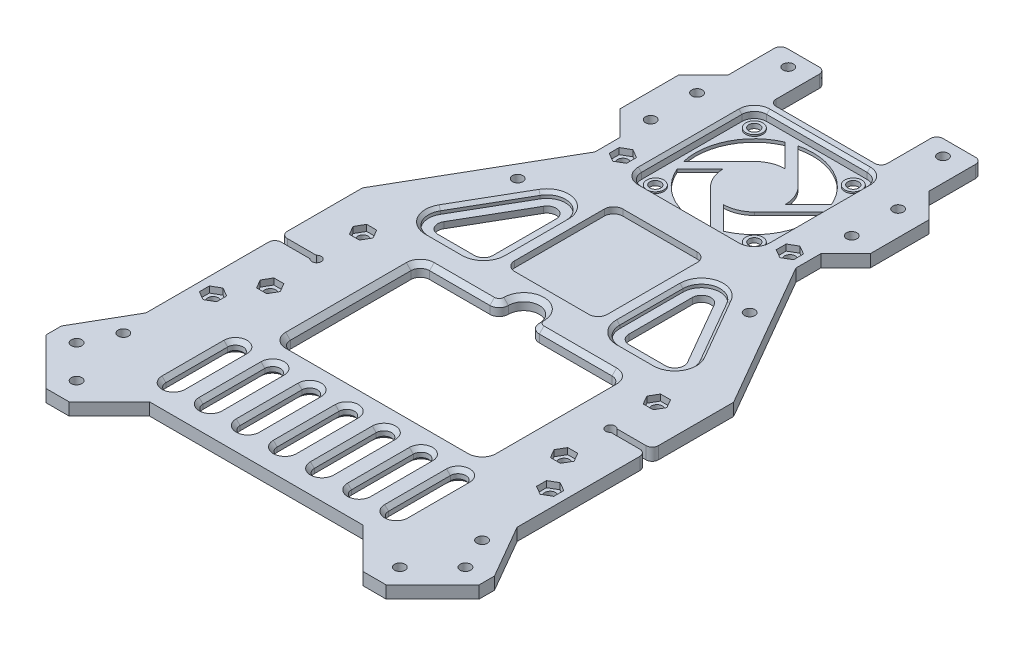
from build123d import *
from build123d.topology import SkipClean

# Parameters (mm, degrees)
SKETCH1_W                                       = 140
SKETCH1_H                                       = 220
BOSS_EXTRUDE1_DEPTH                             = 4
CUT_EXTRUDE1_DEPTH                              = 5
CHAMFER3_SIZE                                   = 15
BOSS_EXTRUDE4_DEPTH                             = 4
CSK_FOR_M3_FLAT_HEAD_MACHINE_SCREW3_D           = 3.4
CSK_FOR_M3_FLAT_HEAD_MACHINE_SCREW3_DEPTH       = 5
CSK_FOR_M3_FLAT_HEAD_MACHINE_SCREW3_CSINK_D     = 6.3
CSK_FOR_M3_FLAT_HEAD_MACHINE_SCREW3_CSINK_ANGLE = 90
CSK_FOR_M3_FLAT_HEAD_MACHINE_SCREW3_TIP         = 1.021463052
SKETCH18_W                                      = 81.237331022
SKETCH18_H                                      = 9.628563132
CUT_EXTRUDE2_DEPTH                              = 5
CUT_EXTRUDE8_DEPTH                              = 10
SKETCH35_W                                      = 65
SKETCH35_H                                      = 45
CUT_EXTRUDE9_DEPTH                              = 131.445390873
FILLET1_R                                       = 3
CUT_EXTRUDE10_DEPTH                             = 131.445390873
SKETCH38_W                                      = 36
SKETCH38_H                                      = 18
CUT_EXTRUDE14_DEPTH                             = 131.445390873
SKETCH39_R                                      = 1.5
CUT_EXTRUDE15_DEPTH                             = 131.445390873
CSK_FOR_M3_FLAT_HEAD_MACHINE_SCREW2_D           = 3.4
CSK_FOR_M3_FLAT_HEAD_MACHINE_SCREW2_DEPTH       = 10
CSK_FOR_M3_FLAT_HEAD_MACHINE_SCREW2_CSINK_D     = 6.3
CSK_FOR_M3_FLAT_HEAD_MACHINE_SCREW2_CSINK_ANGLE = 90
CSK_FOR_M3_FLAT_HEAD_MACHINE_SCREW2_TIP         = 1.021463052
F_3_5_3_5_DIAMETER_HOLE1_AT_2_COUNT             = 2
F_3_5_3_5_DIAMETER_HOLE1_AT_2_PITCH             = 108.54146673
CUT_EXTRUDE16_DEPTH                             = 2
CSK_FOR_M3_FLAT_HEAD_MACHINE_SCREW1_D           = 3.4
CSK_FOR_M3_FLAT_HEAD_MACHINE_SCREW1_DEPTH       = 5
CSK_FOR_M3_FLAT_HEAD_MACHINE_SCREW1_CSINK_D     = 6.3
CSK_FOR_M3_FLAT_HEAD_MACHINE_SCREW1_CSINK_ANGLE = 90
CSK_FOR_M3_FLAT_HEAD_MACHINE_SCREW1_TIP         = 1.021463052
F_3_5_3_5_DIAMETER_HOLE2_D                      = 3.5
CUT_EXTRUDE18_DEPTH                             = 10
CUT_EXTRUDE20_DEPTH                             = 3
SKETCH59_W                                      = 10
SKETCH59_H                                      = 3
CUT_EXTRUDE21_DEPTH                             = 10
FILLET5_R                                       = 3
CUT_EXTRUDE22_DEPTH                             = 131.445390873
FILLET6_R                                       = 3
FILLET7_R                                       = 2
SKETCH61_R                                      = 2.75
SKETCH61_R_2                                    = 1.75
BOSS_EXTRUDE5_DEPTH                             = 0.5
CUT_EXTRUDE23_DEPTH                             = 2
F_3_5_3_5_DIAMETER_HOLE3_D                      = 3.5
CUT_EXTRUDE24_DEPTH                             = 2
CUT_EXTRUDE25_DEPTH                             = 131.445390873
CUT_EXTRUDE26_DEPTH                             = 131.445390873
CHAMFER5_SIZE                                   = 1.5
CHAMFER6_SIZE                                   = 1.25
SKETCH69_W                                      = 30
SKETCH69_H                                      = 35
CUT_EXTRUDE27_DEPTH                             = 2
FILLET8_R                                       = 3
CHAMFER7_SIZE                                   = 1
CHAMFER8_SIZE                                   = 1
FILLET9_R                                       = 2


with BuildPart() as part:
    # Sketch1 → Boss-Extrude1 (new body)
    with BuildSketch(Plane(origin=(0, 0, 0), x_dir=(1, 0, 0), z_dir=(0, 1, 0))):
        Rectangle(SKETCH1_W, SKETCH1_H)
    extrude(amount=BOSS_EXTRUDE1_DEPTH)

    # Sketch8 → Cut-Extrude1 (cut)
    with BuildSketch(Plane(origin=(0, 4, 0), x_dir=(1, 0, 0), z_dir=(0, 1, 0))):
        Polygon((-70, 110), (-32.5, 110), (-32.5, 44.951905284), (-70, -20), align=None)
        Polygon((70, 110), (70, -20), (32.5, 44.951905284), (32.5, 110), align=None)
    extrude(amount=-CUT_EXTRUDE1_DEPTH, mode=Mode.SUBTRACT)

    # Chamfer3
    chamfer3_edges = [part.edges().sort_by_distance(p)[0] for p in [
        (70, 2, 110),
        (-70, 2, 110),
    ]]
    chamfer(chamfer3_edges, length=CHAMFER3_SIZE)

    # Sketch48 → Boss-Extrude4 (add)
    with BuildSketch(Plane(origin=(0, 4, 0), x_dir=(1, 0, 0), z_dir=(0, 1, 0))):
        Polygon((32.5, 53), (32.5, 88), (40.5, 80), (40.5, 61), align=None)
        Polygon((-32.5, 53), (-40.5, 61), (-40.5, 80), (-32.5, 88), align=None)
    extrude(amount=-BOSS_EXTRUDE4_DEPTH)

    # CSK for M3 Flat Head Machine Screw3
    with Locations(Plane.XZ):
        with Locations((37.5, -25), (-37.5, -25), (-25, -100), (25, -100)):
            CounterSinkHole(CSK_FOR_M3_FLAT_HEAD_MACHINE_SCREW3_D / 2, CSK_FOR_M3_FLAT_HEAD_MACHINE_SCREW3_CSINK_D / 2, depth=CSK_FOR_M3_FLAT_HEAD_MACHINE_SCREW3_DEPTH, counter_sink_angle=CSK_FOR_M3_FLAT_HEAD_MACHINE_SCREW3_CSINK_ANGLE)
            with Locations((0, 0, -(CSK_FOR_M3_FLAT_HEAD_MACHINE_SCREW3_DEPTH + CSK_FOR_M3_FLAT_HEAD_MACHINE_SCREW3_TIP / 2))):  # 118° drill point
                Cone(0, CSK_FOR_M3_FLAT_HEAD_MACHINE_SCREW3_D / 2, CSK_FOR_M3_FLAT_HEAD_MACHINE_SCREW3_TIP, mode=Mode.SUBTRACT)

    # Sketch18 → Cut-Extrude2 (cut)
    with BuildSketch(Plane(origin=(0, 4, 0), x_dir=(1, 0, 0), z_dir=(0, 1, 0))):
        with Locations((-5.815131093, 109.814281566)):
            Rectangle(SKETCH18_W, SKETCH18_H)
    extrude(amount=-CUT_EXTRUDE2_DEPTH, mode=Mode.SUBTRACT)

    # Sketch34 → Cut-Extrude8 (cut)
    with BuildSketch(Plane(origin=(0, 4, 0), x_dir=(1, 0, 0), z_dir=(0, 1, 0))):
        Polygon((-70, -20), (-60, -2.679491924), (-60, -72.679491924), (-70, -90), align=None)
        Polygon((70, -90), (70, -20), (60, -2.679491924), (60, -72.679491924), align=None)
    extrude(amount=-CUT_EXTRUDE8_DEPTH, mode=Mode.SUBTRACT)

    # Sketch35 → Cut-Extrude9 (cut, through all)
    with BuildSketch(Plane(origin=(0, 4, 0), x_dir=(1, 0, 0), z_dir=(0, 1, 0))):
        with Locations((2, -36)):
            Rectangle(SKETCH35_W, SKETCH35_H)
    extrude(amount=-CUT_EXTRUDE9_DEPTH, mode=Mode.SUBTRACT)

    # Fillet1
    fillet1_edges = [part.edges().sort_by_distance(p)[0] for p in [
        (34.5, 2, 13.5),
        (34.5, 2, 58.5),
        (-30.5, 2, 58.5),
        (-30.5, 2, 13.5),
    ]]
    fillet(fillet1_edges, radius=FILLET1_R)

    # Sketch36 → Cut-Extrude10 (cut, through all)
    with BuildSketch(Plane(origin=(0, 4, 0), x_dir=(1, 0, 0), z_dir=(0, 1, 0))):
        Polygon((-47.5, -110), (-34.5, -97), (34.5, -97), (47.5, -110), align=None)
    extrude(amount=-CUT_EXTRUDE10_DEPTH, mode=Mode.SUBTRACT)

    # Sketch38 → Cut-Extrude14 (cut, through all)
    with BuildSketch(Plane.XZ):
        with Locations((0, -96)):
            Rectangle(SKETCH38_W, SKETCH38_H)
    extrude(amount=-CUT_EXTRUDE14_DEPTH, mode=Mode.SUBTRACT)

    # Sketch39 → Cut-Extrude15 (cut, through all)
    with BuildSketch(Plane.XZ):
        with Locations(Location((-47.5, 30, 0), (0, 0, 270))):
            Circle(SKETCH39_R)
        with Locations(Location((47.5, 30, 0), (0, 0, 90))):
            Circle(SKETCH39_R)
    extrude(amount=-CUT_EXTRUDE15_DEPTH, mode=Mode.SUBTRACT)

    # CSK for M3 Flat Head Machine Screw2
    with Locations(Plane(origin=(0, 0, 0), x_dir=(-1, 0, 0), z_dir=(0, -1, 0))):
        with Locations((-58, -82), (58, -82)):
            CounterSinkHole(CSK_FOR_M3_FLAT_HEAD_MACHINE_SCREW2_D / 2, CSK_FOR_M3_FLAT_HEAD_MACHINE_SCREW2_CSINK_D / 2, depth=CSK_FOR_M3_FLAT_HEAD_MACHINE_SCREW2_DEPTH, counter_sink_angle=CSK_FOR_M3_FLAT_HEAD_MACHINE_SCREW2_CSINK_ANGLE)
            with Locations((0, 0, -(CSK_FOR_M3_FLAT_HEAD_MACHINE_SCREW2_DEPTH + CSK_FOR_M3_FLAT_HEAD_MACHINE_SCREW2_TIP / 2))):  # 118° drill point
                Cone(0, CSK_FOR_M3_FLAT_HEAD_MACHINE_SCREW2_D / 2, CSK_FOR_M3_FLAT_HEAD_MACHINE_SCREW2_TIP, mode=Mode.SUBTRACT)

    # Sketch46 → Ø3.5 (3.5) Diameter Hole1 (revolve, cut)
    with BuildSketch(Plane(origin=(-54.5, 4, 56.5), x_dir=(0, 0, 1), z_dir=(1, 0, 0))):
        Polygon((0, 0), (0, 6.051506083), (1.75, 5), (1.75, 0), align=None)
    f_3_5_3_5_diameter_hole1 = revolve(axis=Axis((-54.5, 10.35, 56.5), (0, -1, 0)), mode=Mode.SUBTRACT)

    # Ø3.5 (3.5) Diameter Hole1 at 2: Ø3.5 (3.5) Diameter Hole1 ×2
    with Locations(*[Vector(0.2533593918376833, 0, -0.9673722233802454) * (i * F_3_5_3_5_DIAMETER_HOLE1_AT_2_PITCH) for i in range(1, F_3_5_3_5_DIAMETER_HOLE1_AT_2_COUNT)]):
        add(f_3_5_3_5_diameter_hole1, mode=Mode.SUBTRACT)

    # Mirror1: Ø3.5 (3.5) Diameter Hole1 across plane
    add(f_3_5_3_5_diameter_hole1.mirror(Plane(origin=(0, 0, 0), x_dir=(0, 0, 1), z_dir=(1, 0, 0))), mode=Mode.SUBTRACT)

    # Mirror1 copy 1 sketch → Mirror1 copy 1 (revolve, cut)
    with BuildSketch(Plane(origin=(27, 4, -48.5), x_dir=(0, 0, 1), z_dir=(-1, 0, 0))):
        Polygon((0, 0), (0, -6.051506083), (1.75, -5), (1.75, 0), align=None)
    revolve(axis=Axis((27, 10.35, -48.5), (0, 1, 0)), mode=Mode.SUBTRACT)

    # Sketch47 → Cut-Extrude16 (cut)
    with BuildSketch(Plane(origin=(0, 4, 0), x_dir=(1, 0, 0), z_dir=(0, 1, 0))):
        Polygon((29.8, 46.883419246), (29.8, 50.116580754), (27, 51.733161507), (24.2, 50.116580754), (24.2, 46.883419246), (27, 45.266838493), align=None)
        Polygon((57.3, -58.116580754), (57.3, -54.883419246), (54.5, -53.266838493), (51.7, -54.883419246), (51.7, -58.116580754), (54.5, -59.733161507), align=None)
        Polygon((-54.5, -59.733161507), (-57.3, -58.116580754), (-57.3, -54.883419246), (-54.5, -53.266838493), (-51.7, -54.883419246), (-51.7, -58.116580754), align=None)
        Polygon((-27, 45.266838493), (-29.8, 46.883419246), (-29.8, 50.116580754), (-27, 51.733161507), (-24.2, 50.116580754), (-24.2, 46.883419246), align=None)
    extrude(amount=-CUT_EXTRUDE16_DEPTH, mode=Mode.SUBTRACT)

    # CSK for M3 Flat Head Machine Screw1
    with Locations(Plane(origin=(0, 0, 0), x_dir=(-1, 0, 0), z_dir=(0, -1, 0))):
        with Locations((32.5, 63), (32.5, 78), (-32.5, 78), (-32.5, 63), (62.853553391, -92.246951673), (52.246951673, -102.853553391), (-52.246951673, -102.853553391), (-62.853553391, -92.246951673)):
            CounterSinkHole(CSK_FOR_M3_FLAT_HEAD_MACHINE_SCREW1_D / 2, CSK_FOR_M3_FLAT_HEAD_MACHINE_SCREW1_CSINK_D / 2, depth=CSK_FOR_M3_FLAT_HEAD_MACHINE_SCREW1_DEPTH, counter_sink_angle=CSK_FOR_M3_FLAT_HEAD_MACHINE_SCREW1_CSINK_ANGLE)
            with Locations((0, 0, -(CSK_FOR_M3_FLAT_HEAD_MACHINE_SCREW1_DEPTH + CSK_FOR_M3_FLAT_HEAD_MACHINE_SCREW1_TIP / 2))):  # 118° drill point
                Cone(0, CSK_FOR_M3_FLAT_HEAD_MACHINE_SCREW1_D / 2, CSK_FOR_M3_FLAT_HEAD_MACHINE_SCREW1_TIP, mode=Mode.SUBTRACT)

    # Ø3.5 (3.5) Diameter Hole2 (through all)
    with Locations(Plane(origin=(0, 4, 0), x_dir=(1, 0, 0), z_dir=(0, 1, 0))):
        with Locations((16, 80), (-16, 48), (16, 48), (-16, 80)):
            Hole(F_3_5_3_5_DIAMETER_HOLE2_D / 2)

    # Sketch57 → Cut-Extrude18 (cut)
    with BuildSketch(Plane(origin=(0, 4, 0), x_dir=(1, 0, 0), z_dir=(0, 1, 0))):
        with BuildLine():
            ThreePointArc((-7.071067812, 71.071067812), (-3.872983346, 73.219544457), (-0.100005001, 73.999499937))
            Line((-0.100005001, 73.999499937), (-7.540248528, 81.439743465))
            ThreePointArc((-7.540248528, 81.439743465), (-16.975908323, 72.533377795), (-18.494727471, 59.647408153))
            Line((-18.494727471, 59.647408153), (-7.071067812, 71.071067812))
        make_face()
        with BuildLine():
            ThreePointArc((7.071067812, 71.071067812), (9.219544457, 67.872983346), (9.999499937, 64.100005001))
            Line((9.999499937, 64.100005001), (17.439743465, 71.540248528))
            ThreePointArc((17.439743465, 71.540248528), (8.533377795, 80.975908323), (-4.352591847, 82.494727471))
            Line((-4.352591847, 82.494727471), (7.071067812, 71.071067812))
        make_face()
        with BuildLine():
            ThreePointArc((19, 64), (18.873259151, 66.190910548), (18.494727471, 68.352591847))
            Line((18.494727471, 68.352591847), (7.071067812, 56.928932188))
            ThreePointArc((7.071067812, 56.928932188), (3.872983346, 54.780455543), (0.100005001, 54.000500063))
            Line((0.100005001, 54.000500063), (7.540248528, 46.560256535))
            ThreePointArc((7.540248528, 46.560256535), (15.878676299, 53.56603436), (19, 64))
        make_face()
        with BuildLine():
            Line((4.352591847, 45.505272529), (-7.071067812, 56.928932188))
            ThreePointArc((-7.071067812, 56.928932188), (-9.219544457, 60.127016654), (-9.999499937, 63.899994999))
            Line((-9.999499937, 63.899994999), (-17.439743465, 56.459751472))
            ThreePointArc((-17.439743465, 56.459751472), (-8.533377795, 47.024091677), (4.352591847, 45.505272529))
        make_face()
    extrude(amount=-CUT_EXTRUDE18_DEPTH, mode=Mode.SUBTRACT)

    # Sketch58 → Cut-Extrude20 (cut)
    with BuildSketch(Plane(origin=(0, 4, 0), x_dir=(1, 0, 0), z_dir=(0, 1, 0))):
        with BuildLine():
            Line((-16.25, 43.75), (16.25, 43.75))
            ThreePointArc((16.25, 43.75), (19.078427125, 44.921572875), (20.25, 47.75))
            Line((20.25, 47.75), (20.25, 80.25))
            ThreePointArc((20.25, 80.25), (19.078427125, 83.078427125), (16.25, 84.25))
            Line((16.25, 84.25), (-16.25, 84.25))
            ThreePointArc((-16.25, 84.25), (-19.078427125, 83.078427125), (-20.25, 80.25))
            Line((-20.25, 80.25), (-20.25, 47.75))
            ThreePointArc((-20.25, 47.75), (-19.078427125, 44.921572875), (-16.25, 43.75))
        make_face()
    extrude(amount=-CUT_EXTRUDE20_DEPTH, mode=Mode.SUBTRACT)

    # Sketch59 → Cut-Extrude21 (cut)
    with BuildSketch(Plane.XZ):
        with Locations((0, 12)):
            Rectangle(SKETCH59_W, SKETCH59_H)
        with BuildLine():
            Line((5, 10.5), (-5, 10.5))
            ThreePointArc((-5, 10.5), (0, 5.5), (5, 10.5))
        make_face()
    extrude(amount=-CUT_EXTRUDE21_DEPTH, mode=Mode.SUBTRACT)

    # Fillet5
    fillet5_edges = [part.edges().sort_by_distance(p)[0] for p in [
        (5, 2, 13.5),
        (-5, 2, 13.5),
    ]]
    fillet(fillet5_edges, radius=FILLET5_R - 0.0001)  # a hair under: the kernel refuses the full size

    # Sketch60 → Cut-Extrude22 (cut, through all)
    with BuildSketch(Plane.XZ):
        Polygon((-42, 1.5), (-22, 1.5), (-22, -33.141016151), align=None)
        Polygon((22, -33.141016151), (42, 1.5), (22, 1.5), align=None)
    extrude(amount=-CUT_EXTRUDE22_DEPTH, mode=Mode.SUBTRACT)

    # Fillet6
    fillet6_edges = [part.edges().sort_by_distance(p)[0] for p in [
        (-22, 2, -33.141016151),
        (-42, 2, 1.5),
        (-22, 2, 1.5),
        (22, 2, -33.141016151),
        (22, 2, 1.5),
        (42, 2, 1.5),
    ]]
    fillet(fillet6_edges, radius=FILLET6_R)

    # Fillet7
    fillet7_edges = [part.edges().sort_by_distance(p)[0] for p in [
        (-32.5, 2, -105),
        (32.5, 2, -105),
        (18, 2, -105),
        (-18, 2, -105),
        (-18, 2, -87),
        (18, 2, -87),
    ]]
    fillet(fillet7_edges, radius=FILLET7_R)

    # Sketch61 → Boss-Extrude5 (add)
    # profile 1 of 4: a face of its own
    with SkipClean():  # the faces are left unmerged after this step: merging them gives an invalid solid
        with BuildSketch(Plane(origin=(0, 1, 0), x_dir=(1, 0, 0), z_dir=(0, 1, 0))):
            with Locations(Location((-16, 80, 0), (0, 0, 270))):
                Circle(SKETCH61_R)
            with Locations(Location((-16, 80, 0), (0, 0, 270))):
                Circle(SKETCH61_R_2, mode=Mode.SUBTRACT)
        # profile 2 of 4: a face of its own
        with BuildSketch(Plane(origin=(0, 1, 0), x_dir=(1, 0, 0), z_dir=(0, 1, 0))):
            with Locations(Location((16, 80, 0), (0, 0, 270))):
                Circle(SKETCH61_R)
            with Locations(Location((16, 80, 0), (0, 0, 270))):
                Circle(SKETCH61_R_2, mode=Mode.SUBTRACT)
        # profile 3 of 4: a face of its own
        with BuildSketch(Plane(origin=(0, 1, 0), x_dir=(1, 0, 0), z_dir=(0, 1, 0))):
            with Locations(Location((16, 48, 0), (0, 0, 270))):
                Circle(SKETCH61_R)
            with Locations(Location((16, 48, 0), (0, 0, 270))):
                Circle(SKETCH61_R_2, mode=Mode.SUBTRACT)
        # profile 4 of 4: a face of its own
        with BuildSketch(Plane(origin=(0, 1, 0), x_dir=(1, 0, 0), z_dir=(0, 1, 0))):
            with Locations(Location((-16, 48, 0), (0, 0, 270))):
                Circle(SKETCH61_R)
            with Locations(Location((-16, 48, 0), (0, 0, 270))):
                Circle(SKETCH61_R_2, mode=Mode.SUBTRACT)
        extrude(amount=BOSS_EXTRUDE5_DEPTH)

    # Sketch62 → Cut-Extrude23 (cut)
    with SkipClean():  # the faces are left unmerged after this step: merging them gives an invalid solid
        with BuildSketch(Plane(origin=(0, 4, 0), x_dir=(1, 0, 0), z_dir=(0, 1, 0))):
            with BuildLine():
                Line((36.803847577, -4.5), (25, -4.5))
                ThreePointArc((25, -4.5), (20.757359313, -2.742640687), (19, 1.5))
                Line((19, 1.5), (19, 21.944863729))
                ThreePointArc((19, 21.944863729), (23.447085729, 27.740418686), (30.196152423, 24.944863729))
                Line((30.196152423, 24.944863729), (42, 4.5))
                ThreePointArc((42, 4.5), (42, -1.5), (36.803847577, -4.5))
            make_face()
            with BuildLine():
                Line((-19, 1.5), (-19, 21.944863729))
                ThreePointArc((-19, 21.944863729), (-23.447085729, 27.740418686), (-30.196152423, 24.944863729))
                Line((-30.196152423, 24.944863729), (-42, 4.5))
                ThreePointArc((-42, 4.5), (-42, -1.5), (-36.803847577, -4.5))
                Line((-36.803847577, -4.5), (-25, -4.5))
                ThreePointArc((-25, -4.5), (-20.757359313, -2.742640687), (-19, 1.5))
            make_face()
        extrude(amount=-CUT_EXTRUDE23_DEPTH, mode=Mode.SUBTRACT)

    # Ø3.5 (3.5) Diameter Hole3 (through all)
    with Locations(Plane(origin=(0, 0, 0), x_dir=(-1, 0, 0), z_dir=(0, -1, 0))):
        with Locations((-47.5, -45), (47.5, -45), (47.5, -15), (-47.5, -15)):
            Hole(F_3_5_3_5_DIAMETER_HOLE3_D / 2)

    # Sketch66 → Cut-Extrude24 (cut)
    with SkipClean():  # the faces are left unmerged after this step: merging them gives an invalid solid
        with BuildSketch(Plane(origin=(0, 4, 0), x_dir=(1, 0, 0), z_dir=(0, 1, 0))):
            Polygon((-44.266838493, -15), (-45.883419246, -12.2), (-49.116580754, -12.2), (-50.733161507, -15), (-49.116580754, -17.8), (-45.883419246, -17.8), align=None)
            Polygon((-45.883419246, -42.2), (-44.266838493, -45), (-45.883419246, -47.8), (-49.116580754, -47.8), (-50.733161507, -45), (-49.116580754, -42.2), align=None)
            Polygon((44.266838493, -45), (45.883419246, -47.8), (49.116580754, -47.8), (50.733161507, -45), (49.116580754, -42.2), (45.883419246, -42.2), align=None)
            Polygon((45.883419246, -17.8), (44.266838493, -15), (45.883419246, -12.2), (49.116580754, -12.2), (50.733161507, -15), (49.116580754, -17.8), align=None)
        extrude(amount=-CUT_EXTRUDE24_DEPTH, mode=Mode.SUBTRACT)

    # Sketch67 → Cut-Extrude25 (cut, through all)
    with SkipClean():  # the faces are left unmerged after this step: merging them gives an invalid solid
        with BuildSketch(Plane.XZ):
            with BuildLine():
                ThreePointArc((-48.618033989, 29), (-48.901258538, 29.464766865), (-49, 30))
                Line((-49, 30), (-60, 30))
                Line((-60, 30), (-60, 29))
                Line((-60, 29), (-48.618033989, 29))
            make_face()
            with BuildLine():
                Line((-60, 30), (-49, 30))
                ThreePointArc((-49, 30), (-48.901258538, 30.535233135), (-48.618033989, 31))
                Line((-48.618033989, 31), (-60, 31))
                Line((-60, 31), (-60, 30))
            make_face()
        cut_extrude25 = extrude(amount=-CUT_EXTRUDE25_DEPTH, mode=Mode.SUBTRACT)

    # Mirror2: Cut-Extrude25 across plane
    with SkipClean():  # the faces are left unmerged after this step: merging them gives an invalid solid
        add(cut_extrude25.mirror(Plane(origin=(0, 0, 0), x_dir=(0, 0, 1), z_dir=(1, 0, 0))), mode=Mode.SUBTRACT)

    # Sketch68 → Cut-Extrude26 (cut, through all)
    with SkipClean():  # the faces are left unmerged after this step: merging them gives an invalid solid
        with BuildSketch(Plane.XZ):
            with BuildLine():
                Line((-38.5, 67.75), (-38.5, 87.75))
                ThreePointArc((-38.5, 87.75), (-36, 90.25), (-33.5, 87.75))
                Line((-33.5, 87.75), (-33.5, 67.75))
                ThreePointArc((-33.5, 67.75), (-36, 65.25), (-38.5, 67.75))
            make_face()
            with BuildLine():
                Line((-26.5, 67.75), (-26.5, 87.75))
                ThreePointArc((-26.5, 87.75), (-24, 90.25), (-21.5, 87.75))
                Line((-21.5, 87.75), (-21.5, 67.75))
                ThreePointArc((-21.5, 67.75), (-24, 65.25), (-26.5, 67.75))
            make_face()
            with BuildLine():
                Line((-14.5, 67.75), (-14.5, 87.75))
                ThreePointArc((-14.5, 87.75), (-12, 90.25), (-9.5, 87.75))
                Line((-9.5, 87.75), (-9.5, 67.75))
                ThreePointArc((-9.5, 67.75), (-12, 65.25), (-14.5, 67.75))
            make_face()
            with BuildLine():
                Line((-2.5, 67.75), (-2.5, 87.75))
                ThreePointArc((-2.5, 87.75), (0, 90.25), (2.5, 87.75))
                Line((2.5, 87.75), (2.5, 67.75))
                ThreePointArc((2.5, 67.75), (0, 65.25), (-2.5, 67.75))
            make_face()
            with BuildLine():
                Line((9.5, 67.75), (9.5, 87.75))
                ThreePointArc((9.5, 87.75), (12, 90.25), (14.5, 87.75))
                Line((14.5, 87.75), (14.5, 67.75))
                ThreePointArc((14.5, 67.75), (12, 65.25), (9.5, 67.75))
            make_face()
            with BuildLine():
                Line((21.5, 67.75), (21.5, 87.75))
                ThreePointArc((21.5, 87.75), (24, 90.25), (26.5, 87.75))
                Line((26.5, 87.75), (26.5, 67.75))
                ThreePointArc((26.5, 67.75), (24, 65.25), (21.5, 67.75))
            make_face()
            with BuildLine():
                Line((33.5, 67.75), (33.5, 87.75))
                ThreePointArc((33.5, 87.75), (36, 90.25), (38.5, 87.75))
                Line((38.5, 87.75), (38.5, 67.75))
                ThreePointArc((38.5, 67.75), (36, 65.25), (33.5, 67.75))
            make_face()
        extrude(amount=-CUT_EXTRUDE26_DEPTH, mode=Mode.SUBTRACT)

    # Chamfer5
    chamfer5_edges = [part.edges().sort_by_distance(p)[0] for p in [
        (2, 4, 58.5),
        (-30.5, 4, 36),
        (19.74995, 4, 13.5),
        (34.5, 4, 36),
        (-29.621320344, 4, 57.621320344),
        (-29.621320344, 4, 14.378679656),
        (33.621320344, 4, 14.378679656),
        (33.621320344, 4, 57.621320344),
        (0, 4, 5.5),
        (-17.74995, 4, 13.5),
        (-5.878650367, 4, 12.621349633),
        (5.878650367, 4, 12.621349633),
    ]]
    chamfer(chamfer5_edges, length=CHAMFER5_SIZE)

    # Chamfer6
    chamfer6_edges = [part.edges().sort_by_distance(p)[0] for p in [
        (-36, 4, 65.25),
        (-38.5, 4, 77.75),
        (-36, 4, 90.25),
        (-33.5, 4, 77.75),
        (-36, 0, 65.25),
        (-33.5, 0, 77.75),
        (-36, 0, 90.25),
        (-38.5, 0, 77.75),
        (-24, 4, 65.25),
        (-26.5, 4, 77.75),
        (-24, 4, 90.25),
        (-21.5, 4, 77.75),
        (-24, 0, 65.25),
        (-21.5, 0, 77.75),
        (-24, 0, 90.25),
        (-26.5, 0, 77.75),
        (-12, 4, 65.25),
        (-14.5, 4, 77.75),
        (-12, 4, 90.25),
        (-9.5, 4, 77.75),
        (-12, 0, 65.25),
        (-9.5, 0, 77.75),
        (-12, 0, 90.25),
        (-14.5, 0, 77.75),
        (0, 4, 65.25),
        (-2.5, 4, 77.75),
        (0, 4, 90.25),
        (2.5, 4, 77.75),
        (0, 0, 65.25),
        (2.5, 0, 77.75),
        (0, 0, 90.25),
        (-2.5, 0, 77.75),
        (12, 4, 65.25),
        (9.5, 4, 77.75),
        (12, 4, 90.25),
        (14.5, 4, 77.75),
        (12, 0, 65.25),
        (14.5, 0, 77.75),
        (12, 0, 90.25),
        (9.5, 0, 77.75),
        (24, 4, 65.25),
        (21.5, 4, 77.75),
        (24, 4, 90.25),
        (26.5, 4, 77.75),
        (24, 0, 65.25),
        (26.5, 0, 77.75),
        (24, 0, 90.25),
        (21.5, 0, 77.75),
        (36, 4, 65.25),
        (33.5, 4, 77.75),
        (36, 4, 90.25),
        (38.5, 4, 77.75),
        (36, 0, 65.25),
        (38.5, 0, 77.75),
        (36, 0, 90.25),
        (33.5, 0, 77.75),
    ]]
    chamfer(chamfer6_edges, length=CHAMFER6_SIZE)

    # Sketch69 → Cut-Extrude27 (cut)
    with SkipClean():  # the faces are left unmerged after this step: merging them gives an invalid solid
        with BuildSketch(Plane(origin=(0, 4, 0), x_dir=(1, 0, 0), z_dir=(0, 1, 0))):
            with Locations((0, 16)):
                Rectangle(SKETCH69_W, SKETCH69_H)
        extrude(amount=-CUT_EXTRUDE27_DEPTH, mode=Mode.SUBTRACT)

    # Fillet8
    fillet8_edges = [part.edges().sort_by_distance(p)[0] for p in [
        (-15, 3, 1.5),
        (-15, 3, -33.5),
        (15, 3, -33.5),
        (15, 3, 1.5),
    ]]
    fillet(fillet8_edges, radius=FILLET8_R)

    # Chamfer7
    chamfer7_edges = [part.edges().sort_by_distance(p)[0] for p in [
        (-19.078427125, 4, -44.921572875),
        (0, 4, -43.75),
        (19.078427125, 4, -44.921572875),
        (20.25, 4, -64),
        (19.078427125, 4, -83.078427125),
        (0, 4, -84.25),
        (-19.078427125, 4, -83.078427125),
        (-20.25, 4, -64),
    ]]
    chamfer(chamfer7_edges, length=CHAMFER7_SIZE)

    # Chamfer8
    chamfer8_edges = [part.edges().sort_by_distance(p)[0] for p in [
        (23.447085729, 4, -27.740418686),
        (19, 4, -11.722431864),
        (20.757359313, 4, 2.742640687),
        (30.901923789, 4, 4.5),
        (42, 4, 1.5),
        (36.098076211, 4, -14.722431864),
        (-20.757359313, 4, 2.742640687),
        (-19, 4, -11.722431864),
        (-23.447085729, 4, -27.740418686),
        (-36.098076211, 4, -14.722431864),
        (-42, 4, 1.5),
        (-30.901923789, 4, 4.5),
    ]]
    chamfer(chamfer8_edges, length=CHAMFER8_SIZE)

    # Fillet9
    fillet9_edges = [part.edges().sort_by_distance(p)[0] for p in [
        (-60, 2, 29),
        (-60, 2, 31),
        (60, 2, 31),
        (60, 2, 29),
    ]]
    fillet(fillet9_edges, radius=FILLET9_R)


solid = part.part
